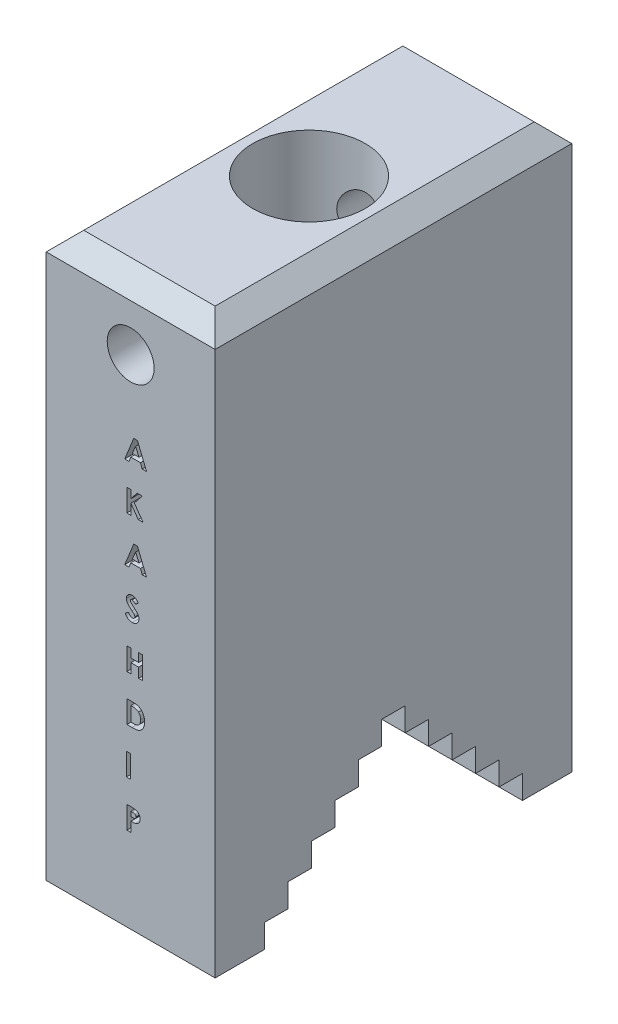
from build123d import *

# Parameters (mm, degrees)
BOSS_EXTRUDE1_DEPTH        = 9
F_12_0MM_DOWEL_HOLE1_D     = 12
F_12_0MM_DOWEL_HOLE1_DEPTH = 18
F_12_0MM_DOWEL_HOLE1_TIP   = 3.605163714
M6X1_0_TAPPED_HOLE1_D      = 5
CHAMFER1_SIZE              = 2
WRAP1_START                = -5
WRAP1_OUTLINE_W            = 0.427403846
WRAP1_OUTLINE_H            = 2.38125
WRAP1_DEPTH                = 5


# Read off the part's stored shape, not the designer's step: Wrap1
with BuildPart() as part:
    # Sketch1 → Boss-Extrude1 (new, symmetric)
    with BuildSketch(Plane(origin=(0, 0, 0), x_dir=(0, 0, -1), z_dir=(1, 0, 0))):
        Polygon((-19, 30), (-19, -30), (-13.75, -30), (-13.75, -27.5), (-11.25, -27.5), (-11.25, -25), (-8.75, -25), (-8.75, -22.5), (-6.25, -22.5), (-6.25, -20), (-3.75, -20), (-3.75, -17.5), (-1.25, -17.5), (-1.25, -15), (1.25, -15), (1.25, -17.5), (3.75, -17.5), (3.75, -20), (6.25, -20), (6.25, -22.5), (8.75, -22.5), (8.75, -25), (11.25, -25), (11.25, -27.5), (13.75, -27.5), (13.75, -30), (19, -30), (19, 30), align=None)
    extrude(amount=BOSS_EXTRUDE1_DEPTH, both=True)

    # Ø12.0mm Dowel Hole1
    with Locations(Plane(origin=(0, 30, 0), x_dir=(1, 0, 0), z_dir=(0, 1, 0))):
        with Locations((0, 0)):
            Hole(F_12_0MM_DOWEL_HOLE1_D / 2, depth=F_12_0MM_DOWEL_HOLE1_DEPTH)
            with Locations((0, 0, -(F_12_0MM_DOWEL_HOLE1_DEPTH + F_12_0MM_DOWEL_HOLE1_TIP / 2))):  # 118° drill point
                Cone(0, F_12_0MM_DOWEL_HOLE1_D / 2, F_12_0MM_DOWEL_HOLE1_TIP, mode=Mode.SUBTRACT)

    # M6x1.0 Tapped Hole1 (through all)
    with Locations(Plane(origin=(0, 0, -19), x_dir=(-1, 0, 0), z_dir=(0, 0, -1))):
        with Locations((0, 23)):
            Hole(M6X1_0_TAPPED_HOLE1_D / 2)

    # Chamfer1
    chamfer1_edges = [part.edges().sort_by_distance(p)[0] for p in [
        (9, 30, 0),
        (-9, 30, 0),
        (0, 30, 19),
        (0, 30, -19),
    ]]
    chamfer(chamfer1_edges, length=CHAMFER1_SIZE)

    # Wrap1 outline → Wrap1 (cut)
    # profile 1 of 8: a face of its own
    with BuildSketch(Plane.XY.offset(19).offset(WRAP1_START)):
        with BuildLine():
            add(Edge.make_bspline(
                [(0.072294283, -18.67893208), (0.103461708, -18.679071592), (0.163590204, -18.67934074), (0.250300443, -18.682604517), (0.330294883, -18.688453404), (0.403555147, -18.695681703), (0.470051111, -18.705815497), (0.529866049, -18.717433099), (0.583012374, -18.731586719), (0.630089389, -18.74838687), (0.67233949, -18.768193592), (0.712321712, -18.789289164), (0.749132453, -18.814465986), (0.784629662, -18.841010606), (0.816783902, -18.871458822), (0.847601148, -18.90378426), (0.875776205, -18.939268922), (0.901439626, -18.977483274), (0.924720304, -19.017721279), (0.945059861, -19.060054871), (0.96155817, -19.104551037), (0.975398201, -19.15092194), (0.986514648, -19.199165556), (0.993914109, -19.24957859), (0.998940195, -19.301809038), (0.999383678, -19.337357113), (0.999607985, -19.355336827)],
                knots=[0, 0, 0, 0, 0.070781161, 0.136551696, 0.197012482, 0.252922694, 0.303686532, 0.349719151, 0.391240471, 0.428478555, 0.463056565, 0.497150358, 0.531002334, 0.564226377, 0.59770067, 0.631421421, 0.665597347, 0.700451436, 0.735880684, 0.771092108, 0.806974845, 0.843534403, 0.880940196, 0.919294384, 0.95918024, 1, 1, 1, 1], degree=3))
            Line((0.072294283, -18.67893208), (-0.404718938, -18.67893208))
            Line((-0.404718938, -18.67893208), (-0.404718938, -21.06018208))
            Line((-0.404718938, -21.06018208), (0.022684908, -21.06018208))
            Line((0.022684908, -21.06018208), (0.022684908, -20.022201311))
            add(Edge.make_bspline(
                [(0.507807354, -19.985948306), (0.495600236, -19.988985457), (0.469155687, -19.995564903), (0.425397222, -20.002244693), (0.374970186, -20.008386349), (0.317711514, -20.013664358), (0.253588197, -20.017252175), (0.182662321, -20.0200541), (0.104901745, -20.022091389), (0.050830116, -20.022163681), (0.022684908, -20.022201311)],
                knots=[0, 0, 0, 0, 0.077372749, 0.167614291, 0.272108317, 0.390015992, 0.52136331, 0.667272254, 0.826809521, 1, 1, 1, 1], degree=3))
            add(Edge.make_bspline(
                [(0.999607985, -19.355336827), (0.999283441, -19.375227357), (0.998645671, -19.414314692), (0.99239347, -19.47161193), (0.981712736, -19.526239659), (0.967753575, -19.578658564), (0.948288518, -19.628006238), (0.926050604, -19.675460132), (0.898690917, -19.719689784), (0.8674281, -19.761248453), (0.833285537, -19.800474033), (0.795452686, -19.836233957), (0.754650657, -19.868772), (0.711115637, -19.898429164), (0.664684184, -19.925145623), (0.6153898, -19.949171549), (0.562895875, -19.969738518), (0.526340686, -19.980494876), (0.507807354, -19.985948306)],
                knots=[0, 0, 0, 0, 0.068875425, 0.135348675, 0.199289315, 0.26155008, 0.322915384, 0.382771997, 0.442843572, 0.502652029, 0.562748843, 0.622739582, 0.682687332, 0.743329247, 0.805012514, 0.86806712, 0.933110571, 1, 1, 1, 1], degree=3))
        make_face()
        with BuildLine():
            add(Edge.make_bspline(
                [(0.173898099, -19.594797464), (0.201413727, -19.594622994), (0.25204289, -19.594301966), (0.321184448, -19.589659712), (0.376747934, -19.582570052), (0.42064412, -19.57240184), (0.455304317, -19.556970232), (0.485196566, -19.539118767), (0.510835912, -19.51654608), (0.533035811, -19.490752923), (0.550783962, -19.461115293), (0.56309138, -19.428115781), (0.571086037, -19.392447742), (0.571824417, -19.367625147), (0.572204139, -19.354859814)],
                knots=[0, 0, 0, 0, 0.155159592, 0.285495954, 0.390502806, 0.470975045, 0.538445527, 0.60365534, 0.666587169, 0.73019895, 0.794944675, 0.860228437, 0.928120706, 1, 1, 1, 1], degree=3))
            Line((0.173898099, -19.594797464), (0.022684908, -19.594797464))
            Line((0.022684908, -19.594797464), (0.022684908, -19.106335926))
            Line((0.022684908, -19.106335926), (0.157202637, -19.106335926))
            add(Edge.make_bspline(
                [(0.460106032, -19.153560235), (0.452546724, -19.149737276), (0.436542121, -19.141643289), (0.409284729, -19.132233438), (0.377830116, -19.124295191), (0.341965926, -19.117706523), (0.301835233, -19.112593033), (0.257445196, -19.108682492), (0.208730492, -19.107109911), (0.17485233, -19.106601037), (0.157202637, -19.106335926)],
                knots=[0, 0, 0, 0, 0.08210116, 0.173824981, 0.278953094, 0.396639095, 0.527315592, 0.671298143, 0.82875438, 1, 1, 1, 1], degree=3))
            add(Edge.make_bspline(
                [(0.572204139, -19.354859814), (0.571828323, -19.343706909), (0.57109915, -19.322067591), (0.565742448, -19.290836689), (0.557205406, -19.261723045), (0.54483556, -19.235030713), (0.528844277, -19.210805048), (0.509347668, -19.189055593), (0.486595912, -19.169316565), (0.469030226, -19.158868396), (0.460106032, -19.153560235)],
                knots=[0, 0, 0, 0, 0.137787685, 0.267341238, 0.390444331, 0.511777883, 0.629508981, 0.747829066, 0.87188531, 1, 1, 1, 1], degree=3))
        make_face(mode=Mode.SUBTRACT)
    # profile 2 of 8: a face of its own
    with BuildSketch(Plane.XY.offset(19).offset(WRAP1_START)):
        with BuildLine():
            add(Edge.make_bspline(
                [(0.133828989, -8.924605157), (0.175814994, -8.924898653), (0.256974417, -8.925465985), (0.374558365, -8.931858454), (0.483896473, -8.941689618), (0.585059224, -8.955214165), (0.677839217, -8.973110844), (0.762116815, -8.99555872), (0.838174873, -9.021471058), (0.906847352, -9.051962183), (0.96953872, -9.087511806), (1.029066175, -9.127111232), (1.085312836, -9.172211104), (1.139068036, -9.221941355), (1.189638052, -9.277211784), (1.237865057, -9.337106914), (1.282568235, -9.402495307), (1.325098865, -9.471809155), (1.363562161, -9.545342203), (1.397111285, -9.622468553), (1.42521559, -9.702691869), (1.448051793, -9.786097648), (1.466254882, -9.872409007), (1.478991217, -9.961800116), (1.486864946, -10.054188213), (1.48766367, -10.116804163), (1.488069524, -10.148621082)],
                knots=[0, 0, 0, 0, 0.060148162, 0.116267077, 0.168653955, 0.217398969, 0.262433523, 0.303932701, 0.342259967, 0.377441339, 0.411406099, 0.445398351, 0.479766387, 0.514584482, 0.550213651, 0.587000908, 0.624662987, 0.663615456, 0.703456428, 0.743450162, 0.784013386, 0.825132536, 0.867264663, 0.910306473, 0.954424205, 1, 1, 1, 1], degree=3))
            Line((0.133828989, -8.924605157), (-0.404718938, -8.924605157))
            Line((-0.404718938, -8.924605157), (-0.404718938, -11.305855157))
            Line((-0.404718938, -11.305855157), (0.141938214, -11.305855157))
            add(Edge.make_bspline(
                [(1.488069524, -10.148621082), (1.487006779, -10.193516826), (1.484914703, -10.281896727), (1.467292226, -10.411593213), (1.438790713, -10.53592023), (1.398714998, -10.653905245), (1.34903184, -10.764497584), (1.289679743, -10.865746996), (1.221528949, -10.957110027), (1.145373417, -11.038131763), (1.062915524, -11.107771043), (0.977225146, -11.16741199), (0.887467501, -11.214443854), (0.808378473, -11.244269089), (0.739798418, -11.262817804), (0.679585871, -11.273780274), (0.611190563, -11.283833519), (0.533974764, -11.291602451), (0.448277205, -11.29853043), (0.353756295, -11.302294823), (0.250718063, -11.305422476), (0.17914827, -11.305707151), (0.141938214, -11.305855157)],
                knots=[0, 0, 0, 0, 0.065772947, 0.129477895, 0.191430088, 0.252445668, 0.311786958, 0.36881755, 0.424091518, 0.478492106, 0.531393744, 0.58200397, 0.631201271, 0.679503008, 0.705561374, 0.735221723, 0.769132486, 0.80685832, 0.848929771, 0.895116661, 0.945469804, 1, 1, 1, 1], degree=3))
        make_face()
        with BuildLine():
            add(Edge.make_bspline(
                [(0.245927096, -10.878451311), (0.272489488, -10.878402637), (0.32357781, -10.878309022), (0.397337783, -10.873850061), (0.465547055, -10.869374494), (0.528017863, -10.860879717), (0.58520485, -10.851417133), (0.636322415, -10.838248653), (0.682424315, -10.82441628), (0.722947424, -10.806805954), (0.760063289, -10.78698436), (0.794428341, -10.763761066), (0.827600238, -10.737972473), (0.858958804, -10.708860102), (0.888622723, -10.676809457), (0.916416487, -10.641655393), (0.942711066, -10.603505169), (0.966831531, -10.562157073), (0.98887294, -10.51804775), (1.00842614, -10.471604465), (1.024638628, -10.422440444), (1.038113456, -10.371015922), (1.047742748, -10.31688319), (1.055709151, -10.260443202), (1.059816063, -10.201472347), (1.060379711, -10.161346606), (1.060665677, -10.140988871)],
                knots=[0, 0, 0, 0, 0.062614648, 0.120428813, 0.174199486, 0.223724664, 0.26902845, 0.310765001, 0.348115258, 0.382378114, 0.414753161, 0.447195432, 0.480044579, 0.513738641, 0.547962504, 0.582917814, 0.619315101, 0.657123545, 0.695686576, 0.735513716, 0.7758232, 0.817652262, 0.860742584, 0.905386927, 0.951998197, 1, 1, 1, 1], degree=3))
            Line((0.245927096, -10.878451311), (0.022684908, -10.878451311))
            Line((0.022684908, -10.878451311), (0.022684908, -9.352009003))
            Line((0.022684908, -9.352009003), (0.18582343, -9.352009003))
            add(Edge.make_bspline(
                [(0.83599245, -9.542814291), (0.818281261, -9.527312714), (0.782108163, -9.495652498), (0.718600089, -9.457715463), (0.64861748, -9.424384059), (0.570559345, -9.397955972), (0.485180081, -9.377055515), (0.391971166, -9.362640981), (0.291431755, -9.353378354), (0.221780394, -9.352475232), (0.18582343, -9.352009003)],
                knots=[0, 0, 0, 0, 0.101663476, 0.207636138, 0.318744567, 0.436679942, 0.563506646, 0.698681208, 0.844446556, 1, 1, 1, 1], degree=3))
            add(Edge.make_bspline(
                [(1.060665677, -10.140988871), (1.06009613, -10.109792566), (1.058985557, -10.048962188), (1.04827543, -9.960361415), (1.030841386, -9.876930515), (1.005964685, -9.798979121), (0.974606833, -9.726288149), (0.935355171, -9.659473447), (0.88989894, -9.597412618), (0.853953392, -9.561005744), (0.83599245, -9.542814291)],
                knots=[0, 0, 0, 0, 0.142276686, 0.277428514, 0.406477152, 0.530595072, 0.650142922, 0.766850697, 0.883502093, 1, 1, 1, 1], degree=3))
        make_face(mode=Mode.SUBTRACT)
    # profile 3 of 8: a face of its own
    with BuildSketch(Plane.XY.offset(19).offset(WRAP1_START)):
        with BuildLine():
            add(Edge.make_bspline(
                [(0.49683605, 0.219144843), (0.483145805, 0.238456357), (0.456862445, 0.275531769), (0.414259859, 0.32517662), (0.371849645, 0.367527373), (0.329238899, 0.402407105), (0.286049935, 0.429603897), (0.242357724, 0.448859525), (0.198409967, 0.461100511), (0.168883859, 0.462624809), (0.154340557, 0.463375612)],
                knots=[0, 0, 0, 0, 0.162420307, 0.31182434, 0.448432767, 0.573381197, 0.689077147, 0.797572901, 0.900293043, 1, 1, 1, 1], degree=3))
            Line((0.49683605, 0.219144843), (0.816434908, 0.511553948))
            add(Edge.make_bspline(
                [(0.159110689, 0.890779459), (0.187167177, 0.889753093), (0.243058685, 0.887708462), (0.325695892, 0.87172012), (0.40641246, 0.846576768), (0.471455383, 0.816244081), (0.523208823, 0.786860792), (0.562873001, 0.759808361), (0.603233436, 0.728818347), (0.644615612, 0.693793093), (0.686250582, 0.654072677), (0.729322229, 0.610602674), (0.773243648, 0.563007402), (0.801785607, 0.529005561), (0.816434908, 0.511553948)],
                knots=[0, 0, 0, 0, 0.10691022, 0.212976528, 0.319776676, 0.428556273, 0.485856803, 0.546558687, 0.611431498, 0.67982091, 0.753158505, 0.830752869, 0.913133075, 1, 1, 1, 1], degree=3))
            add(Edge.make_bspline(
                [(-0.46577663, 0.286880721), (-0.465260107, 0.307267706), (-0.4642425, 0.347432256), (-0.455165293, 0.406488376), (-0.44159906, 0.463472569), (-0.421896996, 0.518176931), (-0.396326095, 0.570532944), (-0.36527123, 0.620796911), (-0.328250177, 0.668506215), (-0.286529948, 0.713629227), (-0.240564939, 0.754866526), (-0.191445485, 0.791262573), (-0.139449606, 0.822003205), (-0.084895388, 0.84750479), (-0.027444781, 0.867024634), (0.032478979, 0.880861272), (0.094961843, 0.889090864), (0.137461338, 0.890209581), (0.159110689, 0.890779459)],
                knots=[0, 0, 0, 0, 0.06317288, 0.12445736, 0.184840915, 0.244566821, 0.304319173, 0.365199786, 0.427420983, 0.491261689, 0.555499002, 0.618604518, 0.680494764, 0.742473305, 0.804990665, 0.868251971, 0.932887217, 1, 1, 1, 1], degree=3))
            add(Edge.make_bspline(
                [(0.134306002, -0.548846443), (0.103996713, -0.523201878), (0.045824013, -0.473982195), (-0.036381392, -0.401286274), (-0.110455823, -0.333345275), (-0.175759493, -0.269319297), (-0.233124472, -0.210390754), (-0.282162259, -0.156081005), (-0.322334152, -0.105971124), (-0.364606407, -0.046619323), (-0.404773501, 0.025704924), (-0.439489269, 0.112719378), (-0.462011394, 0.199722792), (-0.464534685, 0.258132091), (-0.46577663, 0.286880721)],
                knots=[0, 0, 0, 0, 0.112124581, 0.215201009, 0.309902452, 0.395959096, 0.473447494, 0.542140328, 0.602523333, 0.654726333, 0.747804055, 0.835278417, 0.918925243, 1, 1, 1, 1], degree=3))
            add(Edge.make_bspline(
                [(0.450088754, -0.959554826), (0.449304683, -0.945966894), (0.447711918, -0.918364312), (0.435980101, -0.87732371), (0.417639692, -0.836301772), (0.395941696, -0.80265447), (0.373861267, -0.774482495), (0.352747397, -0.750072753), (0.327036288, -0.723104262), (0.296793134, -0.693543097), (0.262417524, -0.661129024), (0.223880501, -0.625865216), (0.180740777, -0.588062307), (0.150249534, -0.562311338), (0.134306002, -0.548846443)],
                knots=[0, 0, 0, 0, 0.076346606, 0.155090822, 0.238351561, 0.32840414, 0.37938386, 0.439617644, 0.509831416, 0.588874645, 0.677436354, 0.77554672, 0.882635872, 1, 1, 1, 1], degree=3))
            add(Edge.make_bspline(
                [(0.178191218, -1.18518208), (0.196723474, -1.184432588), (0.232678749, -1.182978464), (0.284000303, -1.169547161), (0.331053847, -1.148459031), (0.371726583, -1.118369177), (0.406165692, -1.083640912), (0.43158373, -1.045004129), (0.447551514, -1.003200063), (0.449239696, -0.974160209), (0.450088754, -0.959554826)],
                knots=[0, 0, 0, 0, 0.141985893, 0.275473311, 0.404345843, 0.535429711, 0.661427401, 0.77786684, 0.888279749, 1, 1, 1, 1], degree=3))
            add(Edge.make_bspline(
                [(-0.212005597, -0.879893618), (-0.19812712, -0.904017731), (-0.171520894, -0.950265718), (-0.126434158, -1.012405749), (-0.080245098, -1.065618399), (-0.031885865, -1.108963133), (0.018055511, -1.143019523), (0.069820258, -1.167358582), (0.123444745, -1.182424432), (0.15997131, -1.18426432), (0.178191218, -1.18518208)],
                knots=[0, 0, 0, 0, 0.160457921, 0.307611547, 0.442138888, 0.566229194, 0.681222208, 0.789558005, 0.895028892, 1, 1, 1, 1], degree=3))
            Line((-0.212005597, -0.879893618), (-0.587892015, -1.105520872))
            add(Edge.make_bspline(
                [(0.162449782, -1.612585926), (0.142083796, -1.61222462), (0.101747464, -1.611509026), (0.042297808, -1.605666802), (-0.015107555, -1.596238073), (-0.070403964, -1.582723888), (-0.123840537, -1.565599583), (-0.175419471, -1.5446829), (-0.224784698, -1.519649638), (-0.272309739, -1.491014582), (-0.317763564, -1.45776551), (-0.361720919, -1.420582188), (-0.403745176, -1.37889272), (-0.444038171, -1.332795701), (-0.482342098, -1.282160594), (-0.519910781, -1.227692588), (-0.555074556, -1.168380829), (-0.576796783, -1.12677315), (-0.587892015, -1.105520872)],
                knots=[0, 0, 0, 0, 0.063551482, 0.125868382, 0.18624025, 0.244976651, 0.303357688, 0.361230317, 0.418489049, 0.475936712, 0.534203744, 0.594059429, 0.655468694, 0.718771685, 0.784974607, 0.853522316, 0.925182451, 1, 1, 1, 1], degree=3))
            add(Edge.make_bspline(
                [(0.877492601, -0.934750139), (0.877066353, -0.95879969), (0.87623004, -1.005985804), (0.865986809, -1.075035653), (0.851380563, -1.141119356), (0.828796744, -1.203517828), (0.801271719, -1.263255321), (0.766765125, -1.319401315), (0.726241861, -1.37252403), (0.67979598, -1.421673833), (0.628421319, -1.466273872), (0.573317113, -1.505977881), (0.513944525, -1.538758597), (0.450810825, -1.565751179), (0.383949807, -1.586541226), (0.313441123, -1.601907009), (0.239176924, -1.611129309), (0.188393995, -1.612093391), (0.162449782, -1.612585926)],
                knots=[0, 0, 0, 0, 0.065200875, 0.127926544, 0.18904691, 0.248543693, 0.307607127, 0.36724766, 0.426963056, 0.488617128, 0.550391855, 0.611330734, 0.672556085, 0.734024191, 0.797340621, 0.862249627, 0.929625466, 1, 1, 1, 1], degree=3))
            add(Edge.make_bspline(
                [(0.631353778, -0.388570001), (0.652376531, -0.411321122), (0.692789646, -0.455056766), (0.745312447, -0.522833261), (0.788540412, -0.58899694), (0.821982386, -0.65479278), (0.847239109, -0.721170083), (0.865045433, -0.789756751), (0.87570976, -0.86126947), (0.876893749, -0.910068171), (0.877492601, -0.934750139)],
                knots=[0, 0, 0, 0, 0.150833097, 0.289954183, 0.417138648, 0.535255184, 0.648751095, 0.762405462, 0.879826701, 1, 1, 1, 1], degree=3))
            add(Edge.make_bspline(
                [(0.324634277, -0.113810385), (0.344665114, -0.131146064), (0.382679482, -0.164045582), (0.436766378, -0.210741165), (0.484299751, -0.252752042), (0.525972055, -0.28944772), (0.561151577, -0.321213222), (0.589986214, -0.348200384), (0.61282813, -0.369883818), (0.625812421, -0.382980625), (0.631353778, -0.388570001)],
                knots=[0, 0, 0, 0, 0.192952702, 0.366184141, 0.520457298, 0.655012135, 0.770624226, 0.865677185, 0.942674527, 1, 1, 1, 1], degree=3))
            add(Edge.make_bspline(
                [(0.001219313, 0.193386129), (0.006695653, 0.186472509), (0.019301462, 0.170558268), (0.04333816, 0.145352591), (0.073523204, 0.114473431), (0.111018178, 0.07898263), (0.154266564, 0.037603802), (0.205272979, -0.008036436), (0.262569236, -0.05935151), (0.303294088, -0.095085469), (0.324634277, -0.113810385)],
                knots=[0, 0, 0, 0, 0.059234189, 0.136349281, 0.233805212, 0.349411224, 0.48317915, 0.635966856, 0.809243356, 1, 1, 1, 1], degree=3))
            add(Edge.make_bspline(
                [(-0.038372784, 0.307392289), (-0.037952121, 0.297480855), (-0.037104965, 0.277520603), (-0.028922586, 0.248266369), (-0.016589404, 0.219681576), (-0.004804546, 0.202280653), (0.001219313, 0.193386129)],
                knots=[0, 0, 0, 0, 0.241881375, 0.487115475, 0.73783784, 1, 1, 1, 1], degree=3))
            add(Edge.make_bspline(
                [(0.154340557, 0.463375612), (0.140774982, 0.462899869), (0.114583422, 0.461981333), (0.077245409, 0.452851151), (0.044096189, 0.437093799), (0.015168115, 0.416489736), (-0.007747188, 0.391666617), (-0.02604328, 0.365633547), (-0.036345518, 0.336898925), (-0.037701495, 0.317162828), (-0.038372784, 0.307392289)],
                knots=[0, 0, 0, 0, 0.148126258, 0.285992887, 0.416634394, 0.547379946, 0.671582838, 0.784400739, 0.893265576, 1, 1, 1, 1], degree=3))
        make_face()
    # profile 4 of 8: a face of its own
    with BuildSketch(Plane.XY.offset(19).offset(WRAP1_START)):
        Polygon((0.022684908, -4.96330708), (0.022684908, -4.047441695), (-0.404718938, -4.047441695), (-0.404718938, -6.428691695), (0.022684908, -6.428691695), (0.022684908, -5.390710926), (0.846963754, -5.390710926), (0.846963754, -6.428691695), (1.274367601, -6.428691695), (1.274367601, -4.047441695), (0.846963754, -4.047441695), (0.846963754, -4.96330708), align=None)
    # profile 5 of 8: a face of its own
    with BuildSketch(Plane.XY.offset(19).offset(WRAP1_START)):
        Polygon((0.022684908, 9.74593646), (0.022684908, 10.584048689), (-0.404718938, 10.584048689), (-0.404718938, 8.202798689), (0.022684908, 8.202798689), (0.022684908, 9.31948664), (0.805463604, 8.202798689), (1.32016087, 8.202798689), (0.389031062, 9.530803497), (1.237637583, 10.584048689), (0.698135629, 10.584048689), align=None)
    # profile 6 of 8: a face of its own
    with BuildSketch(Plane.XY.offset(19).offset(WRAP1_START)):
        with Locations((-0.252074707, -14.992393618)):
            Rectangle(WRAP1_OUTLINE_W, WRAP1_OUTLINE_H)
    # profile 7 of 8: a face of its own
    with BuildSketch(Plane.XY.offset(19).offset(WRAP1_START)):
        Polygon((1.686507024, 3.325635228), (0.72484837, 5.706885228), (0.328450383, 5.706885228), (-0.633685284, 3.325635228), (-0.177660645, 3.325635228), (0.007420485, 3.814096766), (1.044924241, 3.814096766), (1.230005371, 3.325635228), align=None)
        Polygon((0.883216759, 4.241500612), (0.16960498, 4.241500612), (0.52641087, 5.068164525), align=None, mode=Mode.SUBTRACT)
    # profile 8 of 8: a face of its own
    with BuildSketch(Plane.XY.offset(19).offset(WRAP1_START)):
        Polygon((1.686507024, 13.079962151), (0.72484837, 15.461212151), (0.328450383, 15.461212151), (-0.633685284, 13.079962151), (-0.177660645, 13.079962151), (0.007420485, 13.568423689), (1.044924241, 13.568423689), (1.230005371, 13.079962151), align=None)
        Polygon((0.883216759, 13.995827536), (0.16960498, 13.995827536), (0.52641087, 14.822491448), align=None, mode=Mode.SUBTRACT)
    extrude(amount=WRAP1_DEPTH, mode=Mode.SUBTRACT)


solid = part.part
